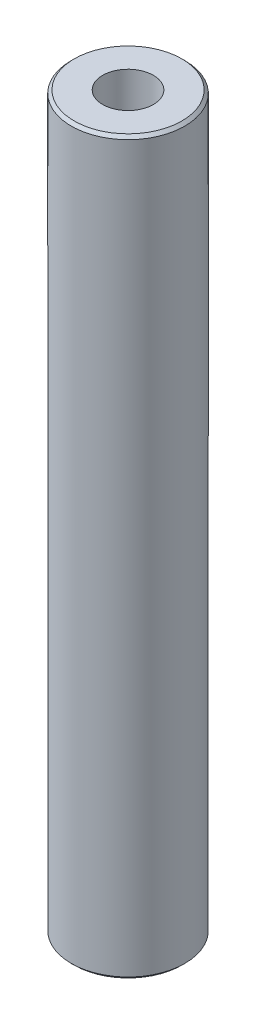
from build123d import *

# Parameters (mm, degrees)
SKETCH1_R           = 17.5
BOSS_EXTRUDE1_DEPTH = 225.261387444
SKETCH2_R           = 7.810302685
CUT_EXTRUDE1_DEPTH  = 227.616841107
CHAMFER1_SIZE       = 0.914165723


with BuildPart() as part:
    # Sketch1 → Boss-Extrude1 (new body)
    with BuildSketch(Plane(origin=(0, 0, 0), x_dir=(1, 0, 0), z_dir=(0, 1, 0))):
        Circle(SKETCH1_R)
    extrude(amount=BOSS_EXTRUDE1_DEPTH)

    # Sketch2 → Cut-Extrude1 (cut, through all)
    with BuildSketch(Plane(origin=(0, 0, 0), x_dir=(1, 0, 0), z_dir=(0, 1, 0))):
        Circle(SKETCH2_R)
    extrude(amount=CUT_EXTRUDE1_DEPTH, mode=Mode.SUBTRACT)

    # Chamfer1
    chamfer1_edges = [part.edges().sort_by_distance(p)[0] for p in [
        (-17.5, 225.261387444, 0),
        (-17.5, 0, 0),
    ]]
    chamfer(chamfer1_edges, length=CHAMFER1_SIZE)


solid = part.part
